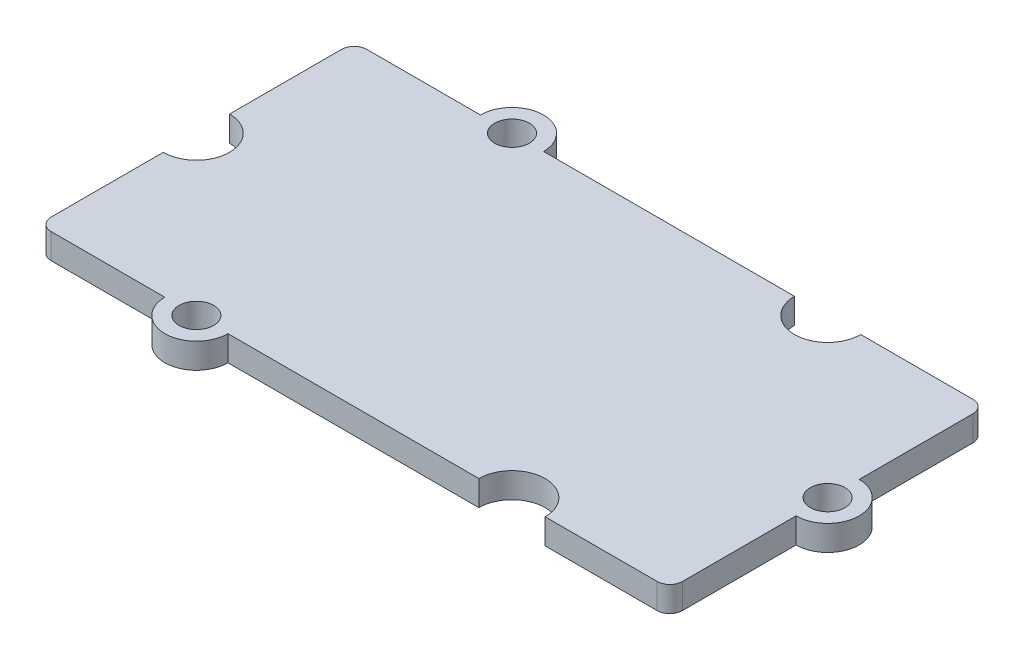
from build123d import *

# Parameters (mm, degrees)
ESQUISSE1_R        = 1.1
BOSS_EXTRU_1_DEPTH = 0.8


with BuildPart() as part:
    # Esquisse1 → Boss.-Extru.1 (new, symmetric)
    with BuildSketch(Plane(origin=(0, 0, 0), x_dir=(1, 0, 0), z_dir=(0, 1, 0))):
        with BuildLine():
            ThreePointArc((-12, -10), (-10, -12), (-8, -10))
            Line((-8, -10), (7.9, -10))
            ThreePointArc((7.9, -10), (10, -7.9), (12.1, -10))
            Line((12.1, -10), (19.2, -10))
            ThreePointArc((19.2, -10), (19.765685425, -9.765685425), (20, -9.2))
            Line((20, -9.2), (20, -2))
            ThreePointArc((20, -2), (22, 0), (20, 2))
            Line((20, 2), (20, 9.2))
            ThreePointArc((20, 9.2), (19.765685425, 9.765685425), (19.2, 10))
            Line((19.2, 10), (12.1, 10))
            ThreePointArc((12.1, 10), (10, 7.9), (7.9, 10))
            Line((7.9, 10), (-8, 10))
            ThreePointArc((-8, 10), (-10, 12), (-12, 10))
            Line((-12, 10), (-19.2, 10))
            ThreePointArc((-19.2, 10), (-19.765685425, 9.765685425), (-20, 9.2))
            Line((-20, 9.2), (-20, 2.1))
            ThreePointArc((-20, 2.1), (-17.9, 0), (-20, -2.1))
            Line((-20, -2.1), (-20, -9.2))
            ThreePointArc((-20, -9.2), (-19.765685425, -9.765685425), (-19.2, -10))
            Line((-19.2, -10), (-12, -10))
        make_face()
        with Locations((-10, -10)):
            Circle(ESQUISSE1_R, mode=Mode.SUBTRACT)
        with Locations((-10, 10)):
            Circle(ESQUISSE1_R, mode=Mode.SUBTRACT)
        with Locations((20, 0)):
            Circle(ESQUISSE1_R, mode=Mode.SUBTRACT)
    extrude(amount=BOSS_EXTRU_1_DEPTH, both=True)


solid = part.part
